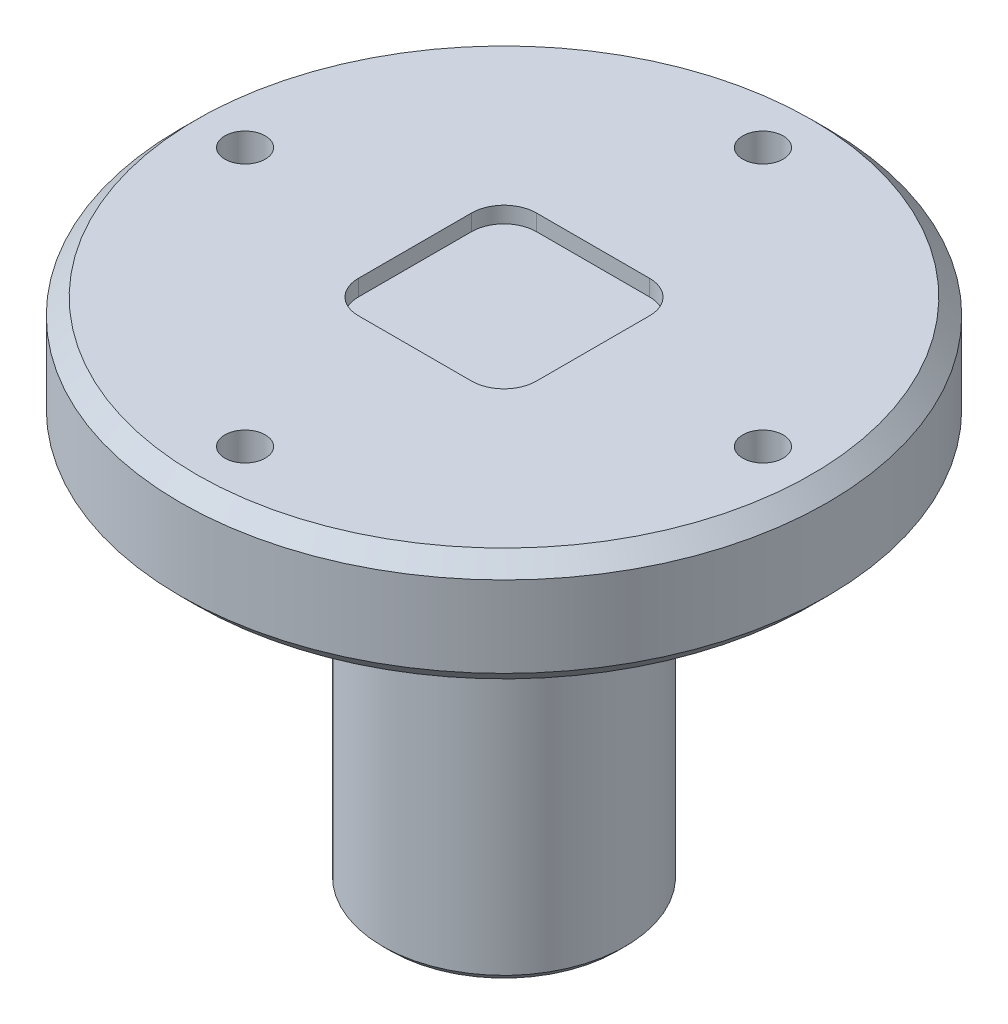
from build123d import *

# Parameters (mm, degrees)
SKETCH_2_W             = 11
SKETCH_2_H             = 11
CUT_EXTRUDE_1_DEPTH    = 1
FILLET_1_R             = 2
SKETCH_5_R             = 7.5
SKETCH_5_R_2           = 5.25
EXTRUDE_1_DEPTH        = 3.5
SKETCH_6_R             = 1.25
CUT_EXTRUDE_M3_1_DEPTH = 40.799497484
CHAMFER_1_SIZE         = 0.5
CUT_EXTRUDE_M3_REACH   = 44.335
SKETCH_7_R             = 1.25
CHAMFER_2_SIZE         = 1
CUT_EXTRUDE_14_DEPTH   = 3.5
FILLET_2_R             = 2.25


with BuildPart() as part:
    # 草图1 → 旋转1 (revolve)
    with BuildSketch(Plane(origin=(0, 0, 0), x_dir=(0, 0, -1), z_dir=(1, 0, 0))):
        Polygon((-7.5, 0), (-5.25, 0), (-5.25, 18), (0, 18), (0, 28), (-20, 28), (-20, 21), (-9, 21), (-9, 18), (-7.5, 18), align=None)
    revolve(axis=Axis((0, 28, 0), (0, -1, 0)))

    # 草图2 → 切除-拉伸1 (cut)
    with BuildSketch(Plane(origin=(0, 28, 0), x_dir=(1, 0, 0), z_dir=(0, 1, 0))):
        Rectangle(SKETCH_2_W, SKETCH_2_H)
    extrude(amount=-CUT_EXTRUDE_1_DEPTH, mode=Mode.SUBTRACT)

    # 圆角1
    fillet_1_edges = [part.edges().sort_by_distance(p)[0] for p in [
        (5.5, 27.5, -5.5),
        (5.5, 27.5, 5.5),
        (-5.5, 27.5, 5.5),
        (-5.5, 27.5, -5.5),
    ]]
    fillet(fillet_1_edges, radius=FILLET_1_R)

    # 草图5 → 凸台-拉伸1 (add)
    with BuildSketch(Plane.XZ):
        with Locations(Location((0, 0, 0), (0, 0, 90))):
            Circle(SKETCH_5_R)
        with Locations(Location((0, 0, 0), (0, 0, 90))):
            Circle(SKETCH_5_R_2, mode=Mode.SUBTRACT)
    extrude(amount=EXTRUDE_1_DEPTH)

    # 草图6 → M3螺纹孔1 (cut, through all)
    with BuildSketch(Plane.XY):
        with Locations((0, 7.5)):
            Circle(SKETCH_6_R)
    extrude(amount=-CUT_EXTRUDE_M3_1_DEPTH, mode=Mode.SUBTRACT)

    # 倒角1
    chamfer_1_edges = [part.edges().sort_by_distance(p)[0] for p in [
        (0, -3.5, -7.5),
        (0, 18, -9),
    ]]
    chamfer(chamfer_1_edges, length=CHAMFER_1_SIZE)

    # 草图7 → M3螺纹孔 (cut, up to next)
    with BuildSketch(Plane(origin=(0, 28, 0), x_dir=(1, 0, 0), z_dir=(0, 1, 0)), mode=Mode.PRIVATE) as cut_extrude_m3_sk1:
        with Locations(Location((0, 16, 0), (0, 0, 270))):
            Circle(SKETCH_7_R)
    cut_extrude_m3_tool1 = extrude(cut_extrude_m3_sk1.sketch, amount=-CUT_EXTRUDE_M3_REACH, mode=Mode.PRIVATE) & part.part
    # 草图7 → M3螺纹孔 (cut, up to next)
    with BuildSketch(Plane(origin=(0, 28, 0), x_dir=(1, 0, 0), z_dir=(0, 1, 0)), mode=Mode.PRIVATE) as cut_extrude_m3_sk2:
        with Locations(Location((16, 0, 0), (0, 0, 270))):
            Circle(SKETCH_7_R)
    cut_extrude_m3_tool2 = extrude(cut_extrude_m3_sk2.sketch, amount=-CUT_EXTRUDE_M3_REACH, mode=Mode.PRIVATE) & part.part
    # 草图7 → M3螺纹孔 (cut, up to next)
    with BuildSketch(Plane(origin=(0, 28, 0), x_dir=(1, 0, 0), z_dir=(0, 1, 0)), mode=Mode.PRIVATE) as cut_extrude_m3_sk3:
        with Locations(Location((0, -16, 0), (0, 0, 270))):
            Circle(SKETCH_7_R)
    cut_extrude_m3_tool3 = extrude(cut_extrude_m3_sk3.sketch, amount=-CUT_EXTRUDE_M3_REACH, mode=Mode.PRIVATE) & part.part
    # 草图7 → M3螺纹孔 (cut, up to next)
    with BuildSketch(Plane(origin=(0, 28, 0), x_dir=(1, 0, 0), z_dir=(0, 1, 0)), mode=Mode.PRIVATE) as cut_extrude_m3_sk4:
        with Locations(Location((-16, 0, 0), (0, 0, 270))):
            Circle(SKETCH_7_R)
    cut_extrude_m3_tool4 = extrude(cut_extrude_m3_sk4.sketch, amount=-CUT_EXTRUDE_M3_REACH, mode=Mode.PRIVATE) & part.part
    add(cut_extrude_m3_tool1.solids().sort_by_distance((0, 28, -16))[0], mode=Mode.SUBTRACT)
    add(cut_extrude_m3_tool2.solids().sort_by_distance((16, 28, 0))[0], mode=Mode.SUBTRACT)
    add(cut_extrude_m3_tool3.solids().sort_by_distance((0, 28, 16))[0], mode=Mode.SUBTRACT)
    add(cut_extrude_m3_tool4.solids().sort_by_distance((-16, 28, 0))[0], mode=Mode.SUBTRACT)

    # 倒角2
    chamfer_2_edges = [part.edges().sort_by_distance(p)[0] for p in [
        (0, 28, -20),
        (0, 21, -20),
    ]]
    chamfer(chamfer_2_edges, length=CHAMFER_2_SIZE)

    # 草图8 → 切除-拉伸14 (cut)
    with BuildSketch(Plane.XZ.offset(-21)):
        with BuildLine():
            Line((-9.866772518, 3.591211505), (-14.095389312, 5.13030215))
            ThreePointArc((-14.095389312, 5.13030215), (0, -15), (14.095389312, 5.13030215))
            Line((14.095389312, 5.13030215), (9.866772518, 3.591211505))
            ThreePointArc((9.866772518, 3.591211505), (0, -10.5), (-9.866772518, 3.591211505))
        make_face()
    extrude(amount=-CUT_EXTRUDE_14_DEPTH, mode=Mode.SUBTRACT)

    # 圆角2
    fillet_2_edges = [part.edges().sort_by_distance(p)[0] for p in [
        (9.866772518, 22.75, 3.591211505),
        (14.095389312, 22.75, 5.13030215),
        (-9.866772518, 22.75, 3.591211505),
        (-14.095389312, 22.75, 5.13030215),
    ]]
    fillet(fillet_2_edges, radius=FILLET_2_R - 0.0001)  # a hair under: the kernel refuses the full size


solid = part.part
